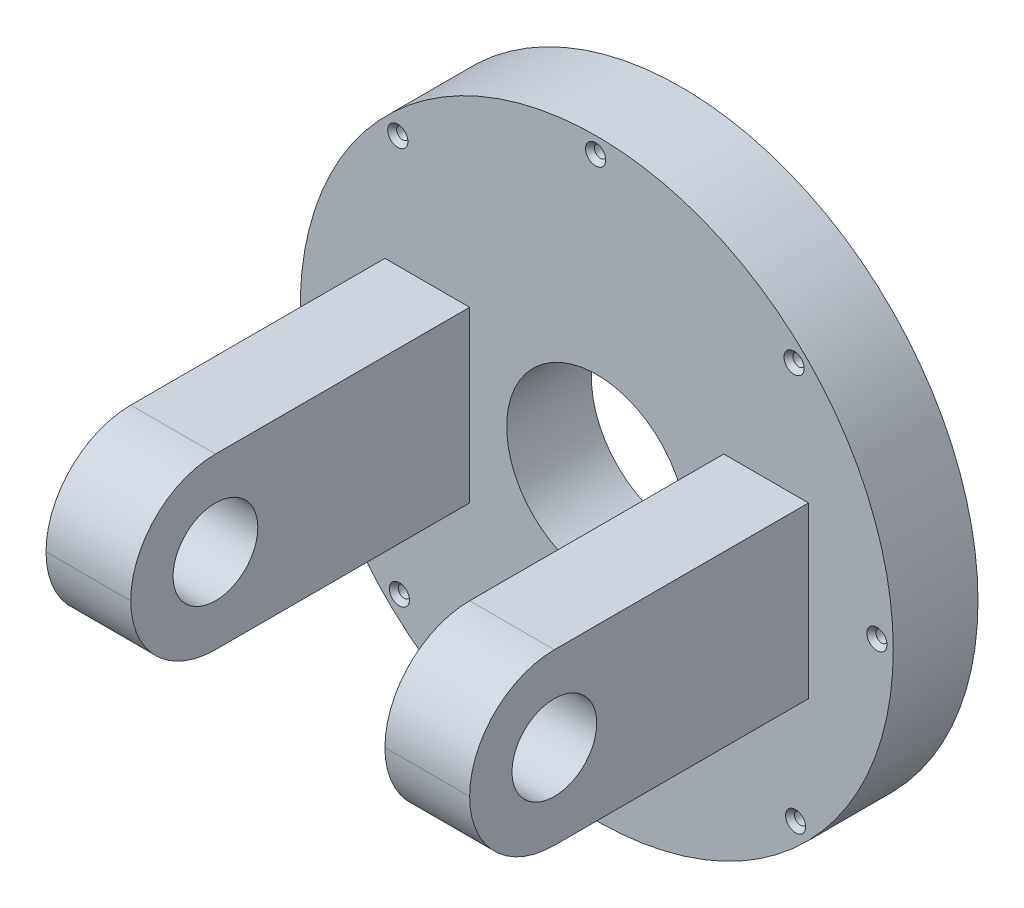
from build123d import *

# Parameters (mm, degrees)
SKETCH1_R                                      = 44.45
BOSS_EXTRUDE1_DEPTH                            = 6.35
SKETCH2_R                                      = 13.5
CUT_EXTRUDE1_DEPTH                             = 65.131856359
CSK_FOR_0_FLAT_HEAD_MACHINE_SCREW1_D           = 1.778
CSK_FOR_0_FLAT_HEAD_MACHINE_SCREW1_CSINK_D     = 3.0226
CSK_FOR_0_FLAT_HEAD_MACHINE_SCREW1_CSINK_ANGLE = 82
CIRPATTERN1_COUNT                              = 8
SKETCH6_W                                      = 12.7
SKETCH6_H                                      = 25.4
BOSS_EXTRUDE2_DEPTH                            = 50.8
FILLET1_R                                      = 12.7
SKETCH7_R                                      = 6.35
CUT_EXTRUDE2_DEPTH                             = 106.111203019


with BuildPart() as part:
    # Sketch1 → Boss-Extrude1 (new, symmetric)
    with BuildSketch(Plane.XY):
        Circle(SKETCH1_R)
    extrude(amount=BOSS_EXTRUDE1_DEPTH, both=True)

    # Sketch2 → Cut-Extrude1 (cut, through all)
    with BuildSketch(Plane.XY.offset(6.35)):
        Circle(SKETCH2_R)
    extrude(amount=-CUT_EXTRUDE1_DEPTH, mode=Mode.SUBTRACT)

    # CSK for #0 Flat Head Machine Screw1 (through all)
    with Locations(Plane(origin=(-0.166965968, 41.999668122, 6.35), x_dir=(1, 0, 0), z_dir=(0, 0, 1))):
        with Locations((0, 0)):
            csk_for_0_flat_head_machine_screw1 = CounterSinkHole(CSK_FOR_0_FLAT_HEAD_MACHINE_SCREW1_D / 2, CSK_FOR_0_FLAT_HEAD_MACHINE_SCREW1_CSINK_D / 2, counter_sink_angle=CSK_FOR_0_FLAT_HEAD_MACHINE_SCREW1_CSINK_ANGLE)

    # CirPattern1: CSK for #0 Flat Head Machine Screw1 ×8 about axis
    cirpattern1_axis = Axis((0, 0, 0), (0, 0, 1))
    for i in range(1, CIRPATTERN1_COUNT):
        add(csk_for_0_flat_head_machine_screw1.rotate(cirpattern1_axis, i * 360 / CIRPATTERN1_COUNT), mode=Mode.SUBTRACT)

    # Sketch6 → Boss-Extrude2 (add)
    with BuildSketch(Plane.XY.offset(6.35)):
        with Locations((-25.4, 0)):
            Rectangle(SKETCH6_W, SKETCH6_H)
        with Locations((25.4, 0)):
            Rectangle(SKETCH6_W, SKETCH6_H)
    extrude(amount=BOSS_EXTRUDE2_DEPTH)

    # Fillet1
    fillet1_edges = [part.edges().sort_by_distance(p)[0] for p in [
        (-25.4, 12.7, 57.15),
        (-25.4, -12.7, 57.15),
        (25.4, -12.7, 57.15),
        (25.4, 12.7, 57.15),
    ]]
    fillet(fillet1_edges, radius=FILLET1_R - 0.0001)  # a hair under: the kernel refuses the full size

    # Sketch7 → Cut-Extrude2 (cut, through all)
    with BuildSketch(Plane(origin=(31.75, 0, 0), x_dir=(0, 0, -1), z_dir=(1, 0, 0))):
        with Locations((-44.45, 0)):
            Circle(SKETCH7_R)
    extrude(amount=-CUT_EXTRUDE2_DEPTH, mode=Mode.SUBTRACT)


solid = part.part
